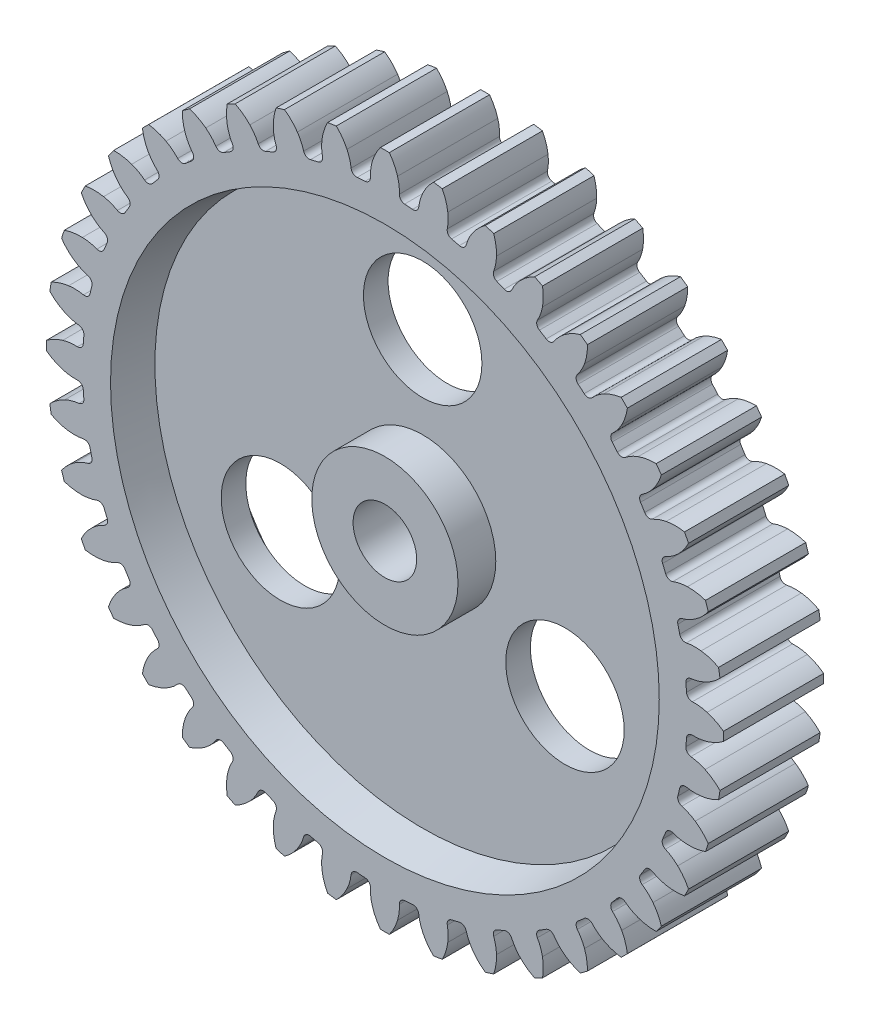
from build123d import *

# Parameters (mm, degrees)
SKETCH1_R                = 20.606249993
BLANK_DISK_DEPTH         = 3.05
GEAR_TOOTH_CUT_DEPTH     = 30.773227529
GEAR_START               = -3.049999996
GEAR_TEETH_REVOLVE_DEPTH = 6.099999992
SKETCH3_R                = 1.93499994
HUB_EXTRUDE_DEPTH        = 30.773227529
SKETCH4_R                = 16.300000039
FRONT_HOLLOW_DEPTH       = 2.299999972
BACK_START               = -2.299999972
SKETCH5_R                = 16.300000039
BACK_HOLLOW_DEPTH        = 2.299999972
SKETCH6_R                = 16.700000001
SKETCH9_R                = 4.44999999
SKETCH9_R_2              = 1.93499994
BACK_HUB_DEPTH           = 2.299999972
SKETCH7_R                = 16.700000001
FRONT_START              = 2.299999972
SKETCH10_R               = 4.44999999
SKETCH10_R_2             = 1.93499994
FRONT_HUB_DEPTH          = 2.299999972


# Read off the part's stored shape, not the designer's step: GEAR TEETH REVOLVE
with BuildPart() as part:
    # Sketch1 → BLANK DISK (new, symmetric)
    with BuildSketch(Plane.XY):
        with Locations(Location((0, 0, 0), (0, 0, 180))):
            Circle(SKETCH1_R)
    extrude(amount=BLANK_DISK_DEPTH, both=True)

    # Sketch2 → GEAR TOOTH CUT (cut, through all)
    with BuildSketch(Plane.XY.offset(3.049999996)):
        with BuildLine():
            ThreePointArc((-20.392964925, -2.957113515), (-20.542727801, -1.616747741), (-20.604488157, -0.269456018))
            ThreePointArc((-20.604488157, -0.269456018), (-20.129999643, -0.565402614), (-19.609858119, -0.770771875))
            ThreePointArc((-19.609858119, -0.770771875), (-19.16724061, -0.862286063), (-18.715644961, -0.88089991))
            ThreePointArc((-18.715644961, -0.88089991), (-18.472155713, -0.968746269), (-18.359155402, -1.201630201))
            ThreePointArc((-18.359155402, -1.201630201), (-18.341721251, -1.443524769), (-18.321100111, -1.685168514))
            ThreePointArc((-18.321100111, -1.685168514), (-18.396278128, -1.932862403), (-18.623027421, -2.057717337))
            ThreePointArc((-18.623027421, -2.057717337), (-19.066151331, -2.146747141), (-19.489003511, -2.30637527))
            ThreePointArc((-19.489003511, -2.30637527), (-19.970614399, -2.590584155), (-20.392964925, -2.957113515))
        make_face()
    extrude(amount=-GEAR_TOOTH_CUT_DEPTH, mode=Mode.SUBTRACT)

    # GEAR TEETH REVOLVE outline → GEAR TEETH REVOLVE (cut)
    with BuildSketch(Plane.XY.offset(GEAR_START)):
        with BuildLine():
            ThreePointArc((-20.308660509, -3.48939065), (-20.036897666, -4.810433527), (-19.679299216, -6.110869099))
            ThreePointArc((-19.679299216, -6.110869099), (-19.31948635, -5.682782146), (-18.888264956, -5.326731802))
            ThreePointArc((-18.888264956, -5.326731802), (-18.495590129, -5.102920305), (-18.071849139, -4.945666754))
            ThreePointArc((-18.071849139, -4.945666754), (-17.867423121, -4.786877587), (-17.831918532, -4.530472788))
            ThreePointArc((-17.831918532, -4.530472788), (-17.890087201, -4.295029935), (-17.945147356, -4.058840794))
            ThreePointArc((-17.945147356, -4.058840794), (-18.093187519, -3.846501191), (-18.347421208, -3.797826478))
            ThreePointArc((-18.347421208, -3.797826478), (-18.796368813, -3.850086921), (-19.247852939, -3.828940058))
            ThreePointArc((-19.247852939, -3.828940058), (-19.793717488, -3.707467295), (-20.308660509, -3.48939065))
        make_face()
        with BuildLine():
            ThreePointArc((-19.512766239, -6.623404903), (-19.037692611, -7.885670476), (-18.481063849, -9.114154805))
            ThreePointArc((-18.481063849, -9.114154805), (-18.192648429, -8.635051179), (-17.822434631, -8.215926518))
            ThreePointArc((-17.822434631, -8.215926518), (-17.469606115, -7.933442636), (-17.075681955, -7.711837442))
            ThreePointArc((-17.075681955, -7.711837442), (-16.898612859, -7.523023958), (-16.903655937, -7.264221786))
            ThreePointArc((-16.903655937, -7.264221786), (-16.99793983, -7.04077721), (-17.089270225, -6.816109255))
            ThreePointArc((-17.089270225, -6.816109255), (-17.268705, -6.629542489), (-17.527423054, -6.621237953))
            ThreePointArc((-17.527423054, -6.621237953), (-17.962668034, -6.743085863), (-18.41190174, -6.79282703))
            ThreePointArc((-18.41190174, -6.79282703), (-18.970048317, -6.758241827), (-19.512766239, -6.623404903))
        make_face()
        with BuildLine():
            ThreePointArc((-18.236402904, -9.594328946), (-17.569716382, -10.766736046), (-16.827763354, -11.893019773))
            ThreePointArc((-16.827763354, -11.893019773), (-16.617847126, -11.374696595), (-16.317756816, -10.902817856))
            ThreePointArc((-16.317756816, -10.902817856), (-16.01346242, -10.568617279), (-15.65905481, -10.288117098))
            ThreePointArc((-15.65905481, -10.288117098), (-15.513702664, -10.073928512), (-15.559169233, -9.819101536))
            ThreePointArc((-15.559169233, -9.819101536), (-15.687246768, -9.613157183), (-15.812598546, -9.405542485))
            ThreePointArc((-15.812598546, -9.405542485), (-16.019009653, -9.249342449), (-16.275841574, -9.281612576))
            ThreePointArc((-16.275841574, -9.281612576), (-16.686666754, -9.470047651), (-17.122588414, -9.589452056))
            ThreePointArc((-17.122588414, -9.589452056), (-17.679273598, -9.642606016), (-18.236402904, -9.594328946))
        make_face()
        with BuildLine():
            ThreePointArc((-16.510998807, -12.329008769), (-15.669115424, -13.382688842), (-14.760107478, -14.379039123))
            ThreePointArc((-14.760107478, -14.379039123), (-14.633859275, -13.83425923), (-14.411281673, -13.321245635))
            ThreePointArc((-14.411281673, -13.321245635), (-14.163014134, -12.94355749), (-13.856849766, -12.611069166))
            ThreePointArc((-13.856849766, -12.611069166), (-13.746793623, -12.376779512), (-13.831564145, -12.132202417))
            ThreePointArc((-13.831564145, -12.132202417), (-13.990281628, -11.948829323), (-14.146568211, -11.763380044))
            ThreePointArc((-14.146568211, -11.763380044), (-14.374873124, -11.641392901), (-14.623494858, -11.713443093))
            ThreePointArc((-14.623494858, -11.713443093), (-14.999784358, -11.963825436), (-15.411660135, -12.149952947))
            ThreePointArc((-15.411660135, -12.149952947), (-15.95317649, -12.289537242), (-16.510998807, -12.329008769))
        make_face()
        with BuildLine():
            ThreePointArc((-14.379039123, -14.760107478), (-13.382688843, -15.669115425), (-12.329008769, -16.510998808))
            ThreePointArc((-12.329008769, -16.510998808), (-12.289537242, -15.95317649), (-12.149952947, -15.411660135))
            ThreePointArc((-12.149952947, -15.411660135), (-11.963825436, -14.999784358), (-11.713443093, -14.623494858))
            ThreePointArc((-11.713443093, -14.623494858), (-11.641392901, -14.374873124), (-11.763380044, -14.146568211))
            ThreePointArc((-11.763380044, -14.146568211), (-11.948829323, -13.990281628), (-12.132202417, -13.831564145))
            ThreePointArc((-12.132202417, -13.831564145), (-12.376779512, -13.746793623), (-12.611069166, -13.856849766))
            ThreePointArc((-12.611069166, -13.856849766), (-12.94355749, -14.163014134), (-13.321245635, -14.411281673))
            ThreePointArc((-13.321245635, -14.411281673), (-13.83425923, -14.633859275), (-14.379039123, -14.760107478))
        make_face()
        with BuildLine():
            ThreePointArc((-11.893019773, -16.827763355), (-10.766736047, -17.569716383), (-9.594328946, -18.236402906))
            ThreePointArc((-9.594328946, -18.236402906), (-9.642606016, -17.679273598), (-9.589452056, -17.122588414))
            ThreePointArc((-9.589452056, -17.122588414), (-9.470047651, -16.686666754), (-9.281612576, -16.275841574))
            ThreePointArc((-9.281612576, -16.275841574), (-9.249342449, -16.019009653), (-9.405542485, -15.812598546))
            ThreePointArc((-9.405542485, -15.812598546), (-9.613157183, -15.687246768), (-9.819101536, -15.559169233))
            ThreePointArc((-9.819101536, -15.559169233), (-10.073928512, -15.513702664), (-10.288117098, -15.65905481))
            ThreePointArc((-10.288117098, -15.65905481), (-10.568617279, -16.01346242), (-10.902817856, -16.317756816))
            ThreePointArc((-10.902817856, -16.317756816), (-11.374696595, -16.617847126), (-11.893019773, -16.827763355))
        make_face()
        with BuildLine():
            ThreePointArc((-9.114154806, -18.48106385), (-7.885670476, -19.037692612), (-6.623404904, -19.51276624))
            ThreePointArc((-6.623404904, -19.51276624), (-6.758241827, -18.970048317), (-6.79282703, -18.41190174))
            ThreePointArc((-6.79282703, -18.41190174), (-6.743085863, -17.962668034), (-6.621237953, -17.527423054))
            ThreePointArc((-6.621237953, -17.527423054), (-6.629542489, -17.268705), (-6.816109255, -17.089270225))
            ThreePointArc((-6.816109255, -17.089270225), (-7.04077721, -16.99793983), (-7.264221786, -16.903655937))
            ThreePointArc((-7.264221786, -16.903655937), (-7.523023958, -16.898612859), (-7.711837442, -17.075681955))
            ThreePointArc((-7.711837442, -17.075681955), (-7.933442636, -17.469606115), (-8.215926518, -17.822434631))
            ThreePointArc((-8.215926518, -17.822434631), (-8.635051179, -18.192648429), (-9.114154806, -18.48106385))
        make_face()
        with BuildLine():
            ThreePointArc((-6.1108691, -19.679299218), (-4.810433528, -20.036897668), (-3.48939065, -20.308660511))
            ThreePointArc((-3.48939065, -20.308660511), (-3.707467295, -19.793717488), (-3.828940058, -19.247852939))
            ThreePointArc((-3.828940058, -19.247852939), (-3.850086921, -18.796368813), (-3.797826478, -18.347421208))
            ThreePointArc((-3.797826478, -18.347421208), (-3.846501191, -18.093187519), (-4.058840794, -17.945147356))
            ThreePointArc((-4.058840794, -17.945147356), (-4.295029935, -17.890087201), (-4.530472788, -17.831918532))
            ThreePointArc((-4.530472788, -17.831918532), (-4.786877587, -17.867423121), (-4.945666754, -18.071849139))
            ThreePointArc((-4.945666754, -18.071849139), (-5.102920305, -18.495590129), (-5.326731802, -18.888264956))
            ThreePointArc((-5.326731802, -18.888264956), (-5.682782146, -19.31948635), (-6.1108691, -19.679299218))
        make_face()
        with BuildLine():
            ThreePointArc((-2.957113515, -20.392964928), (-1.616747741, -20.542727804), (-0.269456018, -20.60448816))
            ThreePointArc((-0.269456018, -20.60448816), (-0.565402614, -20.129999643), (-0.770771875, -19.609858119))
            ThreePointArc((-0.770771875, -19.609858119), (-0.862286063, -19.16724061), (-0.88089991, -18.715644961))
            ThreePointArc((-0.88089991, -18.715644961), (-0.968746269, -18.472155713), (-1.201630201, -18.359155402))
            ThreePointArc((-1.201630201, -18.359155402), (-1.443524768, -18.341721251), (-1.685168514, -18.321100111))
            ThreePointArc((-1.685168514, -18.321100111), (-1.932862403, -18.396278128), (-2.057717337, -18.623027421))
            ThreePointArc((-2.057717337, -18.623027421), (-2.146747141, -19.066151331), (-2.30637527, -19.489003511))
            ThreePointArc((-2.30637527, -19.489003511), (-2.590584155, -19.970614399), (-2.957113515, -20.392964928))
        make_face()
        with BuildLine():
            ThreePointArc((0.269456018, -20.60448816), (1.616747741, -20.542727804), (2.957113515, -20.392964928))
            ThreePointArc((2.957113515, -20.392964928), (2.590584155, -19.970614399), (2.30637527, -19.489003511))
            ThreePointArc((2.30637527, -19.489003511), (2.146747141, -19.066151331), (2.057717337, -18.623027421))
            ThreePointArc((2.057717337, -18.623027421), (1.932862403, -18.396278128), (1.685168514, -18.321100111))
            ThreePointArc((1.685168514, -18.321100111), (1.443524768, -18.341721251), (1.201630201, -18.359155402))
            ThreePointArc((1.201630201, -18.359155402), (0.968746269, -18.472155713), (0.88089991, -18.715644961))
            ThreePointArc((0.88089991, -18.715644961), (0.862286063, -19.16724061), (0.770771875, -19.609858119))
            ThreePointArc((0.770771875, -19.609858119), (0.565402614, -20.129999643), (0.269456018, -20.60448816))
        make_face()
        with BuildLine():
            ThreePointArc((3.48939065, -20.308660511), (4.810433528, -20.036897668), (6.1108691, -19.679299218))
            ThreePointArc((6.1108691, -19.679299218), (5.682782146, -19.31948635), (5.326731802, -18.888264956))
            ThreePointArc((5.326731802, -18.888264956), (5.102920305, -18.495590129), (4.945666754, -18.071849139))
            ThreePointArc((4.945666754, -18.071849139), (4.786877587, -17.867423121), (4.530472788, -17.831918532))
            ThreePointArc((4.530472788, -17.831918532), (4.295029935, -17.890087201), (4.058840794, -17.945147356))
            ThreePointArc((4.058840794, -17.945147356), (3.846501191, -18.093187519), (3.797826478, -18.347421208))
            ThreePointArc((3.797826478, -18.347421208), (3.850086921, -18.796368813), (3.828940058, -19.247852939))
            ThreePointArc((3.828940058, -19.247852939), (3.707467295, -19.793717488), (3.48939065, -20.308660511))
        make_face()
        with BuildLine():
            ThreePointArc((6.623404904, -19.512766241), (7.885670476, -19.037692613), (9.114154806, -18.48106385))
            ThreePointArc((9.114154806, -18.48106385), (8.635051179, -18.192648429), (8.215926518, -17.822434631))
            ThreePointArc((8.215926518, -17.822434631), (7.933442636, -17.469606115), (7.711837442, -17.075681955))
            ThreePointArc((7.711837442, -17.075681955), (7.523023958, -16.898612859), (7.264221786, -16.903655937))
            ThreePointArc((7.264221786, -16.903655937), (7.04077721, -16.99793983), (6.816109255, -17.089270225))
            ThreePointArc((6.816109255, -17.089270225), (6.629542489, -17.268705), (6.621237953, -17.527423054))
            ThreePointArc((6.621237953, -17.527423054), (6.743085863, -17.962668034), (6.79282703, -18.41190174))
            ThreePointArc((6.79282703, -18.41190174), (6.758241827, -18.970048317), (6.623404904, -19.512766241))
        make_face()
        with BuildLine():
            ThreePointArc((9.594328946, -18.236402906), (10.766736047, -17.569716383), (11.893019773, -16.827763355))
            ThreePointArc((11.893019773, -16.827763355), (11.374696595, -16.617847126), (10.902817856, -16.317756816))
            ThreePointArc((10.902817856, -16.317756816), (10.568617279, -16.01346242), (10.288117098, -15.65905481))
            ThreePointArc((10.288117098, -15.65905481), (10.073928512, -15.513702664), (9.819101536, -15.559169233))
            ThreePointArc((9.819101536, -15.559169233), (9.613157183, -15.687246768), (9.405542485, -15.812598546))
            ThreePointArc((9.405542485, -15.812598546), (9.249342449, -16.019009653), (9.281612576, -16.275841574))
            ThreePointArc((9.281612576, -16.275841574), (9.470047651, -16.686666754), (9.589452056, -17.122588414))
            ThreePointArc((9.589452056, -17.122588414), (9.642606016, -17.679273598), (9.594328946, -18.236402906))
        make_face()
        with BuildLine():
            ThreePointArc((12.329008769, -16.510998808), (13.382688843, -15.669115425), (14.379039123, -14.760107478))
            ThreePointArc((14.379039123, -14.760107478), (13.83425923, -14.633859275), (13.321245635, -14.411281673))
            ThreePointArc((13.321245635, -14.411281673), (12.94355749, -14.163014134), (12.611069166, -13.856849766))
            ThreePointArc((12.611069166, -13.856849766), (12.376779512, -13.746793623), (12.132202417, -13.831564145))
            ThreePointArc((12.132202417, -13.831564145), (11.948829323, -13.990281628), (11.763380044, -14.146568211))
            ThreePointArc((11.763380044, -14.146568211), (11.641392901, -14.374873124), (11.713443093, -14.623494858))
            ThreePointArc((11.713443093, -14.623494858), (11.963825436, -14.999784358), (12.149952947, -15.411660135))
            ThreePointArc((12.149952947, -15.411660135), (12.289537242, -15.95317649), (12.329008769, -16.510998808))
        make_face()
        with BuildLine():
            ThreePointArc((14.760107478, -14.379039123), (15.669115425, -13.382688843), (16.510998807, -12.329008769))
            ThreePointArc((16.510998807, -12.329008769), (15.95317649, -12.289537242), (15.411660135, -12.149952947))
            ThreePointArc((15.411660135, -12.149952947), (14.999784358, -11.963825436), (14.623494858, -11.713443093))
            ThreePointArc((14.623494858, -11.713443093), (14.374873124, -11.641392901), (14.146568211, -11.763380044))
            ThreePointArc((14.146568211, -11.763380044), (13.990281628, -11.948829323), (13.831564145, -12.132202417))
            ThreePointArc((13.831564145, -12.132202417), (13.746793623, -12.376779512), (13.856849766, -12.611069166))
            ThreePointArc((13.856849766, -12.611069166), (14.163014134, -12.94355749), (14.411281673, -13.321245635))
            ThreePointArc((14.411281673, -13.321245635), (14.633859275, -13.83425923), (14.760107478, -14.379039123))
        make_face()
        with BuildLine():
            ThreePointArc((16.827763355, -11.893019773), (17.569716382, -10.766736046), (18.236402905, -9.594328946))
            ThreePointArc((18.236402905, -9.594328946), (17.679273598, -9.642606016), (17.122588414, -9.589452056))
            ThreePointArc((17.122588414, -9.589452056), (16.686666754, -9.470047651), (16.275841574, -9.281612576))
            ThreePointArc((16.275841574, -9.281612576), (16.019009653, -9.249342449), (15.812598546, -9.405542485))
            ThreePointArc((15.812598546, -9.405542485), (15.687246768, -9.613157183), (15.559169233, -9.819101536))
            ThreePointArc((15.559169233, -9.819101536), (15.513702664, -10.073928512), (15.65905481, -10.288117098))
            ThreePointArc((15.65905481, -10.288117098), (16.01346242, -10.568617279), (16.317756816, -10.902817856))
            ThreePointArc((16.317756816, -10.902817856), (16.617847126, -11.374696595), (16.827763355, -11.893019773))
        make_face()
        with BuildLine():
            ThreePointArc((18.481063849, -9.114154806), (19.037692611, -7.885670476), (19.512766239, -6.623404903))
            ThreePointArc((19.512766239, -6.623404903), (18.970048317, -6.758241827), (18.41190174, -6.79282703))
            ThreePointArc((18.41190174, -6.79282703), (17.962668034, -6.743085863), (17.527423054, -6.621237953))
            ThreePointArc((17.527423054, -6.621237953), (17.268705, -6.629542489), (17.089270225, -6.816109255))
            ThreePointArc((17.089270225, -6.816109255), (16.99793983, -7.04077721), (16.903655937, -7.264221786))
            ThreePointArc((16.903655937, -7.264221786), (16.898612859, -7.523023958), (17.075681955, -7.711837442))
            ThreePointArc((17.075681955, -7.711837442), (17.469606115, -7.933442636), (17.822434631, -8.215926518))
            ThreePointArc((17.822434631, -8.215926518), (18.192648429, -8.635051179), (18.481063849, -9.114154806))
        make_face()
        with BuildLine():
            ThreePointArc((19.679299217, -6.110869099), (20.036897666, -4.810433528), (20.308660509, -3.48939065))
            ThreePointArc((20.308660509, -3.48939065), (19.793717488, -3.707467295), (19.247852939, -3.828940058))
            ThreePointArc((19.247852939, -3.828940058), (18.796368813, -3.850086921), (18.347421208, -3.797826478))
            ThreePointArc((18.347421208, -3.797826478), (18.093187519, -3.846501191), (17.945147356, -4.058840794))
            ThreePointArc((17.945147356, -4.058840794), (17.890087201, -4.295029935), (17.831918532, -4.530472788))
            ThreePointArc((17.831918532, -4.530472788), (17.867423121, -4.786877587), (18.071849139, -4.945666754))
            ThreePointArc((18.071849139, -4.945666754), (18.495590129, -5.102920305), (18.888264956, -5.326731802))
            ThreePointArc((18.888264956, -5.326731802), (19.31948635, -5.682782146), (19.679299217, -6.110869099))
        make_face()
        with BuildLine():
            ThreePointArc((20.392964925, -2.957113515), (20.542727801, -1.616747741), (20.604488157, -0.269456018))
            ThreePointArc((20.604488157, -0.269456018), (20.129999643, -0.565402614), (19.609858119, -0.770771875))
            ThreePointArc((19.609858119, -0.770771875), (19.16724061, -0.862286063), (18.715644961, -0.88089991))
            ThreePointArc((18.715644961, -0.88089991), (18.472155713, -0.968746269), (18.359155402, -1.201630201))
            ThreePointArc((18.359155402, -1.201630201), (18.341721251, -1.443524768), (18.321100111, -1.685168514))
            ThreePointArc((18.321100111, -1.685168514), (18.396278128, -1.932862403), (18.623027421, -2.057717337))
            ThreePointArc((18.623027421, -2.057717337), (19.066151331, -2.146747141), (19.489003511, -2.30637527))
            ThreePointArc((19.489003511, -2.30637527), (19.970614399, -2.590584155), (20.392964925, -2.957113515))
        make_face()
        with BuildLine():
            ThreePointArc((20.604488157, 0.269456018), (20.542727801, 1.616747741), (20.392964925, 2.957113515))
            ThreePointArc((20.392964925, 2.957113515), (19.970614399, 2.590584155), (19.489003511, 2.30637527))
            ThreePointArc((19.489003511, 2.30637527), (19.066151331, 2.146747141), (18.623027421, 2.057717337))
            ThreePointArc((18.623027421, 2.057717337), (18.396278128, 1.932862403), (18.321100111, 1.685168514))
            ThreePointArc((18.321100111, 1.685168514), (18.341721251, 1.443524768), (18.359155402, 1.201630201))
            ThreePointArc((18.359155402, 1.201630201), (18.472155713, 0.968746269), (18.715644961, 0.88089991))
            ThreePointArc((18.715644961, 0.88089991), (19.16724061, 0.862286063), (19.609858119, 0.770771875))
            ThreePointArc((19.609858119, 0.770771875), (20.129999643, 0.565402614), (20.604488157, 0.269456018))
        make_face()
        with BuildLine():
            ThreePointArc((20.308660508, 3.48939065), (20.036897665, 4.810433527), (19.679299215, 6.110869099))
            ThreePointArc((19.679299215, 6.110869099), (19.31948635, 5.682782146), (18.888264956, 5.326731802))
            ThreePointArc((18.888264956, 5.326731802), (18.495590129, 5.102920305), (18.071849139, 4.945666754))
            ThreePointArc((18.071849139, 4.945666754), (17.867423121, 4.786877587), (17.831918532, 4.530472788))
            ThreePointArc((17.831918532, 4.530472788), (17.890087201, 4.295029935), (17.945147356, 4.058840794))
            ThreePointArc((17.945147356, 4.058840794), (18.093187519, 3.846501191), (18.347421208, 3.797826478))
            ThreePointArc((18.347421208, 3.797826478), (18.796368813, 3.850086921), (19.247852939, 3.828940058))
            ThreePointArc((19.247852939, 3.828940058), (19.793717488, 3.707467295), (20.308660508, 3.48939065))
        make_face()
        with BuildLine():
            ThreePointArc((19.512766237, 6.623404903), (19.037692609, 7.885670475), (18.481063847, 9.114154805))
            ThreePointArc((18.481063847, 9.114154805), (18.192648429, 8.635051179), (17.822434631, 8.215926518))
            ThreePointArc((17.822434631, 8.215926518), (17.469606115, 7.933442636), (17.075681955, 7.711837442))
            ThreePointArc((17.075681955, 7.711837442), (16.898612859, 7.523023958), (16.903655937, 7.264221786))
            ThreePointArc((16.903655937, 7.264221786), (16.99793983, 7.04077721), (17.089270225, 6.816109255))
            ThreePointArc((17.089270225, 6.816109255), (17.268705, 6.629542489), (17.527423054, 6.621237953))
            ThreePointArc((17.527423054, 6.621237953), (17.962668034, 6.743085863), (18.41190174, 6.79282703))
            ThreePointArc((18.41190174, 6.79282703), (18.970048317, 6.758241827), (19.512766237, 6.623404903))
        make_face()
        with BuildLine():
            ThreePointArc((18.236402902, 9.594328945), (17.569716379, 10.766736045), (16.827763352, 11.893019771))
            ThreePointArc((16.827763352, 11.893019771), (16.617847126, 11.374696595), (16.317756816, 10.902817856))
            ThreePointArc((16.317756816, 10.902817856), (16.01346242, 10.568617279), (15.65905481, 10.288117098))
            ThreePointArc((15.65905481, 10.288117098), (15.513702664, 10.073928512), (15.559169233, 9.819101536))
            ThreePointArc((15.559169233, 9.819101536), (15.687246768, 9.613157183), (15.812598546, 9.405542485))
            ThreePointArc((15.812598546, 9.405542485), (16.019009653, 9.249342449), (16.275841574, 9.281612576))
            ThreePointArc((16.275841574, 9.281612576), (16.686666754, 9.470047651), (17.122588414, 9.589452056))
            ThreePointArc((17.122588414, 9.589452056), (17.679273598, 9.642606016), (18.236402902, 9.594328945))
        make_face()
        with BuildLine():
            ThreePointArc((16.510998805, 12.329008767), (15.669115422, 13.38268884), (14.760107475, 14.37903912))
            ThreePointArc((14.760107475, 14.37903912), (14.633859275, 13.83425923), (14.411281673, 13.321245635))
            ThreePointArc((14.411281673, 13.321245635), (14.163014134, 12.94355749), (13.856849766, 12.611069166))
            ThreePointArc((13.856849766, 12.611069166), (13.746793623, 12.376779512), (13.831564145, 12.132202417))
            ThreePointArc((13.831564145, 12.132202417), (13.990281628, 11.948829323), (14.146568211, 11.763380044))
            ThreePointArc((14.146568211, 11.763380044), (14.374873124, 11.641392901), (14.623494858, 11.713443093))
            ThreePointArc((14.623494858, 11.713443093), (14.999784358, 11.963825436), (15.411660135, 12.149952947))
            ThreePointArc((15.411660135, 12.149952947), (15.95317649, 12.289537242), (16.510998805, 12.329008767))
        make_face()
        with BuildLine():
            ThreePointArc((14.37903912, 14.760107475), (13.38268884, 15.669115421), (12.329008767, 16.510998804))
            ThreePointArc((12.329008767, 16.510998804), (12.289537242, 15.95317649), (12.149952947, 15.411660135))
            ThreePointArc((12.149952947, 15.411660135), (11.963825436, 14.999784358), (11.713443093, 14.623494858))
            ThreePointArc((11.713443093, 14.623494858), (11.641392901, 14.374873124), (11.763380044, 14.146568211))
            ThreePointArc((11.763380044, 14.146568211), (11.948829323, 13.990281628), (12.132202417, 13.831564145))
            ThreePointArc((12.132202417, 13.831564145), (12.376779512, 13.746793623), (12.611069166, 13.856849766))
            ThreePointArc((12.611069166, 13.856849766), (12.94355749, 14.163014134), (13.321245635, 14.411281673))
            ThreePointArc((13.321245635, 14.411281673), (13.83425923, 14.633859275), (14.37903912, 14.760107475))
        make_face()
        with BuildLine():
            ThreePointArc((11.893019771, 16.827763351), (10.766736044, 17.569716379), (9.594328944, 18.236402901))
            ThreePointArc((9.594328944, 18.236402901), (9.642606016, 17.679273598), (9.589452056, 17.122588414))
            ThreePointArc((9.589452056, 17.122588414), (9.470047651, 16.686666754), (9.281612576, 16.275841574))
            ThreePointArc((9.281612576, 16.275841574), (9.249342449, 16.019009653), (9.405542485, 15.812598546))
            ThreePointArc((9.405542485, 15.812598546), (9.613157183, 15.687246768), (9.819101536, 15.559169233))
            ThreePointArc((9.819101536, 15.559169233), (10.073928512, 15.513702664), (10.288117098, 15.65905481))
            ThreePointArc((10.288117098, 15.65905481), (10.568617279, 16.01346242), (10.902817856, 16.317756816))
            ThreePointArc((10.902817856, 16.317756816), (11.374696595, 16.617847126), (11.893019771, 16.827763351))
        make_face()
        with BuildLine():
            ThreePointArc((9.114154804, 18.481063846), (7.885670474, 19.037692608), (6.623404902, 19.512766235))
            ThreePointArc((6.623404902, 19.512766235), (6.758241827, 18.970048317), (6.79282703, 18.41190174))
            ThreePointArc((6.79282703, 18.41190174), (6.743085863, 17.962668034), (6.621237953, 17.527423054))
            ThreePointArc((6.621237953, 17.527423054), (6.629542489, 17.268705), (6.816109255, 17.089270225))
            ThreePointArc((6.816109255, 17.089270225), (7.04077721, 16.99793983), (7.264221786, 16.903655937))
            ThreePointArc((7.264221786, 16.903655937), (7.523023958, 16.898612859), (7.711837442, 17.075681955))
            ThreePointArc((7.711837442, 17.075681955), (7.933442636, 17.469606115), (8.215926518, 17.822434631))
            ThreePointArc((8.215926518, 17.822434631), (8.635051179, 18.192648429), (9.114154804, 18.481063846))
        make_face()
        with BuildLine():
            ThreePointArc((6.110869098, 19.679299213), (4.810433527, 20.036897663), (3.489390649, 20.308660506))
            ThreePointArc((3.489390649, 20.308660506), (3.707467295, 19.793717488), (3.828940058, 19.247852939))
            ThreePointArc((3.828940058, 19.247852939), (3.850086921, 18.796368813), (3.797826478, 18.347421208))
            ThreePointArc((3.797826478, 18.347421208), (3.846501191, 18.093187519), (4.058840794, 17.945147356))
            ThreePointArc((4.058840794, 17.945147356), (4.295029935, 17.890087201), (4.530472788, 17.831918532))
            ThreePointArc((4.530472788, 17.831918532), (4.786877587, 17.867423121), (4.945666754, 18.071849139))
            ThreePointArc((4.945666754, 18.071849139), (5.102920305, 18.495590129), (5.326731802, 18.888264956))
            ThreePointArc((5.326731802, 18.888264956), (5.682782146, 19.31948635), (6.110869098, 19.679299213))
        make_face()
        with BuildLine():
            ThreePointArc((2.957113515, 20.392964922), (1.616747741, 20.542727798), (0.269456018, 20.604488154))
            ThreePointArc((0.269456018, 20.604488154), (0.565402614, 20.129999643), (0.770771875, 19.609858119))
            ThreePointArc((0.770771875, 19.609858119), (0.862286063, 19.16724061), (0.88089991, 18.715644961))
            ThreePointArc((0.88089991, 18.715644961), (0.968746269, 18.472155713), (1.201630201, 18.359155402))
            ThreePointArc((1.201630201, 18.359155402), (1.443524768, 18.341721251), (1.685168514, 18.321100111))
            ThreePointArc((1.685168514, 18.321100111), (1.932862403, 18.396278128), (2.057717337, 18.623027421))
            ThreePointArc((2.057717337, 18.623027421), (2.146747141, 19.066151331), (2.30637527, 19.489003511))
            ThreePointArc((2.30637527, 19.489003511), (2.590584155, 19.970614399), (2.957113515, 20.392964922))
        make_face()
        with BuildLine():
            ThreePointArc((-0.269456018, 20.604488154), (-1.616747741, 20.542727798), (-2.957113515, 20.392964922))
            ThreePointArc((-2.957113515, 20.392964922), (-2.590584155, 19.970614399), (-2.30637527, 19.489003511))
            ThreePointArc((-2.30637527, 19.489003511), (-2.146747141, 19.066151331), (-2.057717337, 18.623027421))
            ThreePointArc((-2.057717337, 18.623027421), (-1.932862403, 18.396278128), (-1.685168514, 18.321100111))
            ThreePointArc((-1.685168514, 18.321100111), (-1.443524768, 18.341721251), (-1.201630201, 18.359155402))
            ThreePointArc((-1.201630201, 18.359155402), (-0.968746269, 18.472155713), (-0.88089991, 18.715644961))
            ThreePointArc((-0.88089991, 18.715644961), (-0.862286063, 19.16724061), (-0.770771875, 19.609858119))
            ThreePointArc((-0.770771875, 19.609858119), (-0.565402614, 20.129999643), (-0.269456018, 20.604488154))
        make_face()
        with BuildLine():
            ThreePointArc((-3.489390649, 20.308660506), (-4.810433527, 20.036897662), (-6.110869098, 19.679299213))
            ThreePointArc((-6.110869098, 19.679299213), (-5.682782146, 19.31948635), (-5.326731802, 18.888264956))
            ThreePointArc((-5.326731802, 18.888264956), (-5.102920305, 18.495590129), (-4.945666754, 18.071849139))
            ThreePointArc((-4.945666754, 18.071849139), (-4.786877587, 17.867423121), (-4.530472788, 17.831918532))
            ThreePointArc((-4.530472788, 17.831918532), (-4.295029935, 17.890087201), (-4.058840794, 17.945147356))
            ThreePointArc((-4.058840794, 17.945147356), (-3.846501191, 18.093187519), (-3.797826478, 18.347421208))
            ThreePointArc((-3.797826478, 18.347421208), (-3.850086921, 18.796368813), (-3.828940058, 19.247852939))
            ThreePointArc((-3.828940058, 19.247852939), (-3.707467295, 19.793717488), (-3.489390649, 20.308660506))
        make_face()
        with BuildLine():
            ThreePointArc((-6.623404902, 19.512766235), (-7.885670474, 19.037692608), (-9.114154804, 18.481063846))
            ThreePointArc((-9.114154804, 18.481063846), (-8.635051179, 18.192648429), (-8.215926518, 17.822434631))
            ThreePointArc((-8.215926518, 17.822434631), (-7.933442636, 17.469606115), (-7.711837442, 17.075681955))
            ThreePointArc((-7.711837442, 17.075681955), (-7.523023958, 16.898612859), (-7.264221786, 16.903655937))
            ThreePointArc((-7.264221786, 16.903655937), (-7.04077721, 16.99793983), (-6.816109255, 17.089270225))
            ThreePointArc((-6.816109255, 17.089270225), (-6.629542489, 17.268705), (-6.621237953, 17.527423054))
            ThreePointArc((-6.621237953, 17.527423054), (-6.743085863, 17.962668034), (-6.79282703, 18.41190174))
            ThreePointArc((-6.79282703, 18.41190174), (-6.758241827, 18.970048317), (-6.623404902, 19.512766235))
        make_face()
        with BuildLine():
            ThreePointArc((-9.594328944, 18.236402901), (-10.766736044, 17.569716378), (-11.893019771, 16.827763351))
            ThreePointArc((-11.893019771, 16.827763351), (-11.374696595, 16.617847126), (-10.902817856, 16.317756816))
            ThreePointArc((-10.902817856, 16.317756816), (-10.568617279, 16.01346242), (-10.288117098, 15.65905481))
            ThreePointArc((-10.288117098, 15.65905481), (-10.073928512, 15.513702664), (-9.819101536, 15.559169233))
            ThreePointArc((-9.819101536, 15.559169233), (-9.613157183, 15.687246768), (-9.405542485, 15.812598546))
            ThreePointArc((-9.405542485, 15.812598546), (-9.249342449, 16.019009653), (-9.281612576, 16.275841574))
            ThreePointArc((-9.281612576, 16.275841574), (-9.470047651, 16.686666754), (-9.589452056, 17.122588414))
            ThreePointArc((-9.589452056, 17.122588414), (-9.642606016, 17.679273598), (-9.594328944, 18.236402901))
        make_face()
        with BuildLine():
            ThreePointArc((-12.329008766, 16.510998804), (-13.38268884, 15.669115421), (-14.37903912, 14.760107475))
            ThreePointArc((-14.37903912, 14.760107475), (-13.83425923, 14.633859275), (-13.321245635, 14.411281673))
            ThreePointArc((-13.321245635, 14.411281673), (-12.94355749, 14.163014134), (-12.611069166, 13.856849766))
            ThreePointArc((-12.611069166, 13.856849766), (-12.376779512, 13.746793623), (-12.132202417, 13.831564145))
            ThreePointArc((-12.132202417, 13.831564145), (-11.948829323, 13.990281628), (-11.763380044, 14.146568211))
            ThreePointArc((-11.763380044, 14.146568211), (-11.641392901, 14.374873124), (-11.713443093, 14.623494858))
            ThreePointArc((-11.713443093, 14.623494858), (-11.963825436, 14.999784358), (-12.149952947, 15.411660135))
            ThreePointArc((-12.149952947, 15.411660135), (-12.289537242, 15.95317649), (-12.329008766, 16.510998804))
        make_face()
        with BuildLine():
            ThreePointArc((-14.760107475, 14.37903912), (-15.669115422, 13.38268884), (-16.510998804, 12.329008767))
            ThreePointArc((-16.510998804, 12.329008767), (-15.95317649, 12.289537242), (-15.411660135, 12.149952947))
            ThreePointArc((-15.411660135, 12.149952947), (-14.999784358, 11.963825436), (-14.623494858, 11.713443093))
            ThreePointArc((-14.623494858, 11.713443093), (-14.374873124, 11.641392901), (-14.146568211, 11.763380044))
            ThreePointArc((-14.146568211, 11.763380044), (-13.990281628, 11.948829323), (-13.831564145, 12.132202417))
            ThreePointArc((-13.831564145, 12.132202417), (-13.746793623, 12.376779512), (-13.856849766, 12.611069166))
            ThreePointArc((-13.856849766, 12.611069166), (-14.163014134, 12.94355749), (-14.411281673, 13.321245635))
            ThreePointArc((-14.411281673, 13.321245635), (-14.633859275, 13.83425923), (-14.760107475, 14.37903912))
        make_face()
        with BuildLine():
            ThreePointArc((-16.827763352, 11.893019771), (-17.569716379, 10.766736044), (-18.236402902, 9.594328945))
            ThreePointArc((-18.236402902, 9.594328945), (-17.679273598, 9.642606016), (-17.122588414, 9.589452056))
            ThreePointArc((-17.122588414, 9.589452056), (-16.686666754, 9.470047651), (-16.275841574, 9.281612576))
            ThreePointArc((-16.275841574, 9.281612576), (-16.019009653, 9.249342449), (-15.812598546, 9.405542485))
            ThreePointArc((-15.812598546, 9.405542485), (-15.687246768, 9.613157183), (-15.559169233, 9.819101536))
            ThreePointArc((-15.559169233, 9.819101536), (-15.513702664, 10.073928512), (-15.65905481, 10.288117098))
            ThreePointArc((-15.65905481, 10.288117098), (-16.01346242, 10.568617279), (-16.317756816, 10.902817856))
            ThreePointArc((-16.317756816, 10.902817856), (-16.617847126, 11.374696595), (-16.827763352, 11.893019771))
        make_face()
        with BuildLine():
            ThreePointArc((-18.481063847, 9.114154804), (-19.037692609, 7.885670475), (-19.512766237, 6.623404903))
            ThreePointArc((-19.512766237, 6.623404903), (-18.970048317, 6.758241827), (-18.41190174, 6.79282703))
            ThreePointArc((-18.41190174, 6.79282703), (-17.962668034, 6.743085863), (-17.527423054, 6.621237953))
            ThreePointArc((-17.527423054, 6.621237953), (-17.268705, 6.629542489), (-17.089270225, 6.816109255))
            ThreePointArc((-17.089270225, 6.816109255), (-16.99793983, 7.04077721), (-16.903655937, 7.264221786))
            ThreePointArc((-16.903655937, 7.264221786), (-16.898612859, 7.523023958), (-17.075681955, 7.711837442))
            ThreePointArc((-17.075681955, 7.711837442), (-17.469606115, 7.933442636), (-17.822434631, 8.215926518))
            ThreePointArc((-17.822434631, 8.215926518), (-18.192648429, 8.635051179), (-18.481063847, 9.114154804))
        make_face()
        with BuildLine():
            ThreePointArc((-19.679299215, 6.110869099), (-20.036897664, 4.810433527), (-20.308660508, 3.48939065))
            ThreePointArc((-20.308660508, 3.48939065), (-19.793717488, 3.707467295), (-19.247852939, 3.828940058))
            ThreePointArc((-19.247852939, 3.828940058), (-18.796368813, 3.850086921), (-18.347421208, 3.797826478))
            ThreePointArc((-18.347421208, 3.797826478), (-18.093187519, 3.846501191), (-17.945147356, 4.058840794))
            ThreePointArc((-17.945147356, 4.058840794), (-17.890087201, 4.295029935), (-17.831918532, 4.530472788))
            ThreePointArc((-17.831918532, 4.530472788), (-17.867423121, 4.786877587), (-18.071849139, 4.945666754))
            ThreePointArc((-18.071849139, 4.945666754), (-18.495590129, 5.102920305), (-18.888264956, 5.326731802))
            ThreePointArc((-18.888264956, 5.326731802), (-19.31948635, 5.682782146), (-19.679299215, 6.110869099))
        make_face()
        with BuildLine():
            ThreePointArc((-18.359155402, 1.201630201), (-18.341721251, 1.443524768), (-18.321100111, 1.685168514))
            ThreePointArc((-18.321100111, 1.685168514), (-18.396278128, 1.932862403), (-18.623027421, 2.057717337))
            ThreePointArc((-18.623027421, 2.057717337), (-19.066151331, 2.146747141), (-19.489003511, 2.30637527))
            ThreePointArc((-19.489003511, 2.30637527), (-19.970614399, 2.590584155), (-20.392964925, 2.957113515))
            ThreePointArc((-20.392964925, 2.957113515), (-20.542727801, 1.616747741), (-20.604488157, 0.269456018))
            ThreePointArc((-20.604488157, 0.269456018), (-20.129999643, 0.565402614), (-19.609858119, 0.770771875))
            ThreePointArc((-19.609858119, 0.770771875), (-19.16724061, 0.862286063), (-18.715644961, 0.88089991))
            ThreePointArc((-18.715644961, 0.88089991), (-18.472155713, 0.968746269), (-18.359155402, 1.201630201))
        make_face()
    extrude(amount=GEAR_TEETH_REVOLVE_DEPTH, mode=Mode.SUBTRACT)

    # Sketch3 → HUB EXTRUDE (cut, through all)
    with BuildSketch(Plane.XY.offset(3.049999996)):
        with BuildLine():
            Line((-1.802500014, 6.87797846), (0, 10.000000066))
            Line((0, 10.000000066), (1.802500015, 6.87797846))
            ThreePointArc((1.802500014, 6.87797846), (3.122021606, 8.197500051), (3.605000029, 10.000000066))
            ThreePointArc((3.605000029, 10.000000066), (-1.802500015, 13.122021672), (-1.802500014, 6.87797846))
        make_face()
        with BuildLine():
            Line((1.802500015, 6.87797846), (0, 10.000000066))
            Line((0, 10.000000066), (-1.802500014, 6.87797846))
            ThreePointArc((-1.802500014, 6.87797846), (0, 6.395000037), (1.802500014, 6.87797846))
        make_face()
        with BuildLine():
            ThreePointArc((12.265254124, -5.000000033), (10.46275411, -1.877978427), (6.857754081, -1.877978427))
            Line((6.857754081, -1.877978427), (8.660254095, -5.000000033))
            Line((8.660254095, -5.000000033), (5.055254066, -5.000000033))
            ThreePointArc((5.055254066, -5.000000033), (8.660254095, -8.605000062), (12.265254124, -5.000000033))
        make_face()
        with BuildLine():
            Line((8.660254095, -5.000000033), (6.857754081, -1.877978427))
            ThreePointArc((6.857754081, -1.877978427), (5.538232489, -3.197500018), (5.055254066, -5.000000033))
            Line((5.055254066, -5.000000033), (8.660254095, -5.000000033))
        make_face()
        with BuildLine():
            ThreePointArc((-5.055254066, -5.000000033), (-5.538232489, -3.197500018), (-6.857754081, -1.877978427))
            Line((-6.857754081, -1.877978427), (-8.660254095, -5.000000033))
            Line((-8.660254095, -5.000000033), (-5.055254066, -5.000000033))
        make_face()
        with BuildLine():
            Line((-8.660254095, -5.000000033), (-6.857754081, -1.877978427))
            ThreePointArc((-6.857754081, -1.877978427), (-11.782275701, -6.802500048), (-5.055254066, -5.000000033))
            Line((-5.055254066, -5.000000033), (-8.660254095, -5.000000033))
        make_face()
        Circle(SKETCH3_R)
    extrude(amount=-HUB_EXTRUDE_DEPTH, mode=Mode.SUBTRACT)

    # Sketch4 → FRONT HOLLOW (cut)
    with BuildSketch(Plane.XY.offset(3.049999996)):
        Circle(SKETCH4_R)
    extrude(amount=-FRONT_HOLLOW_DEPTH, mode=Mode.SUBTRACT)

    # Sketch5 → BACK HOLLOW (cut)
    with BuildSketch(Plane(origin=(0, 0, -3.049999996), x_dir=(-1, 0, 0), z_dir=(0, 0, -1)).offset(BACK_START)):
        with Locations(Location((0, 0, 0), (0, 0, 180))):
            Circle(SKETCH5_R)
    extrude(amount=BACK_HOLLOW_DEPTH, mode=Mode.SUBTRACT)

    # Sketch6 → section 0 of back_loft
    with BuildSketch(Plane(origin=(0, 0, -3.049999996), x_dir=(-1, 0, 0), z_dir=(0, 0, -1)), mode=Mode.PRIVATE) as back_loft_s0:
        Circle(SKETCH6_R)
    # loft up to a face of the part (back_loft)
    loft([back_loft_s0.sketch, Face(Wire([part.edges().sort_by_distance((-11.158117853, -11.882188655, -0.750000024))[0]]))], mode=Mode.SUBTRACT)

    # Sketch9 → BACK HUB (add)
    with BuildSketch(Plane(origin=(0, 0, -0.750000024), x_dir=(-1, 0, 0), z_dir=(0, 0, -1))):
        with Locations(Location((0, 0, 0), (0, 0, 180))):
            Circle(SKETCH9_R)
        with Locations(Location((0, 0, 0), (0, 0, 180))):
            Circle(SKETCH9_R_2, mode=Mode.SUBTRACT)
    extrude(amount=BACK_HUB_DEPTH)

    # Sketch7 → section 0 of front_loft
    with BuildSketch(Plane.XY.offset(3.049999996), mode=Mode.PRIVATE) as front_loft_s0:
        Circle(SKETCH7_R)
    # loft up to a face of the part (front_loft)
    loft([front_loft_s0.sketch, Face(Wire([part.edges().sort_by_distance((-11.158117853, 11.882188655, 0.750000024))[0]]))], mode=Mode.SUBTRACT)

    # Sketch10 → FRONT HUB (add)
    with BuildSketch(Plane.XY.offset(0.750000024).offset(FRONT_START)):
        Circle(SKETCH10_R)
        Circle(SKETCH10_R_2, mode=Mode.SUBTRACT)
    extrude(amount=-FRONT_HUB_DEPTH)


solid = part.part
